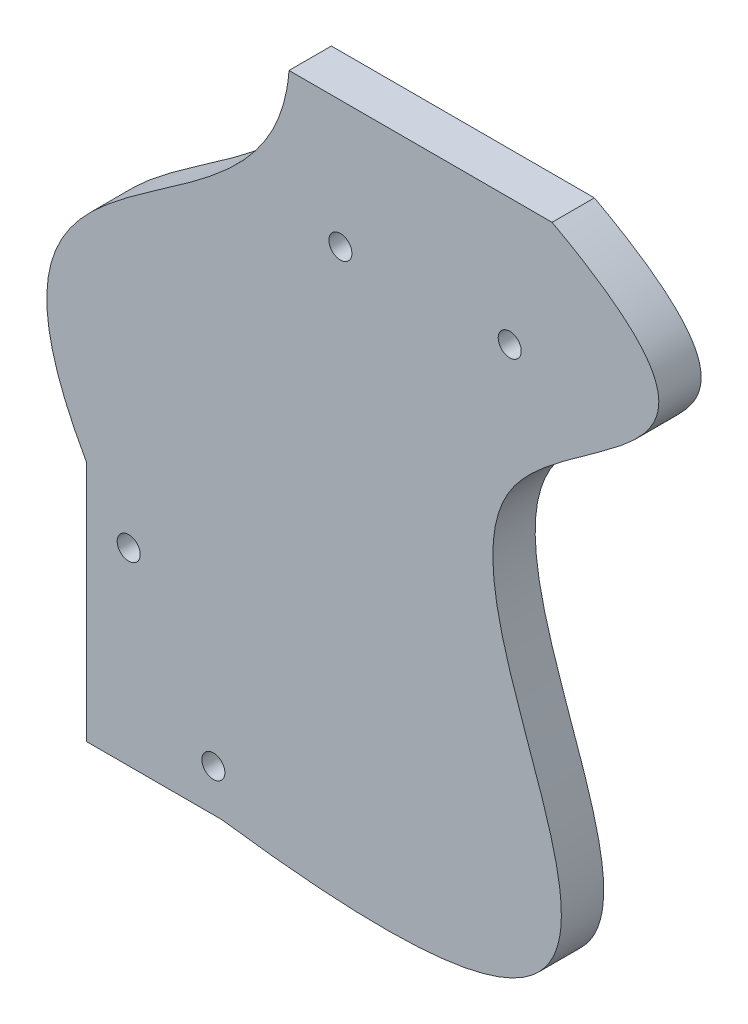
from build123d import *

# Parameters (mm, degrees)
BOSS_EXTRUDE1_DEPTH       = 6.35
TAP_DRILL_FOR_8_32_TAP1_D = 3.4544


# Read off the part's stored shape, not the designer's step: Boss-Extrude1
with BuildPart() as part:
    # Boss-Extrude1 outline → Boss-Extrude1 (new body)
    with BuildSketch(Plane.XY):
        with BuildLine():
            Line((0, -66.04), (0, -102.362))
            Line((0, -102.362), (20.32, -102.362))
            add(Edge.make_bspline(
                [(20.32, -102.362), (112.724526082, -115.037668854), (12.136897546, -33.992901458), (105.278452179, -19.075705978), (69.85, 0)],
                knots=[0, 0, 0, 0, 0.643707462, 1, 1, 1, 1], degree=3))
            Line((69.85, 0), (30.395783043, 0))
            add(Edge.make_bspline(
                [(0, -66.04), (-23.02244586, -25.459793903), (28.212204822, -29.698834111), (30.395783043, 0)],
                knots=[0, 0, 0, 0, 1, 1, 1, 1], degree=3))
        make_face()
    extrude(amount=BOSS_EXTRUDE1_DEPTH)

    # Tap Drill for #8-32 Tap1 (through all)
    with Locations(Plane(origin=(0, 0, 0), x_dir=(-1, 0, 0), z_dir=(0, 0, -1))):
        with Locations((-63.5, -19.05), (-38.1, -19.05), (-6.35, -74.041), (-19.05, -96.0374)):
            Hole(TAP_DRILL_FOR_8_32_TAP1_D / 2)


solid = part.part
